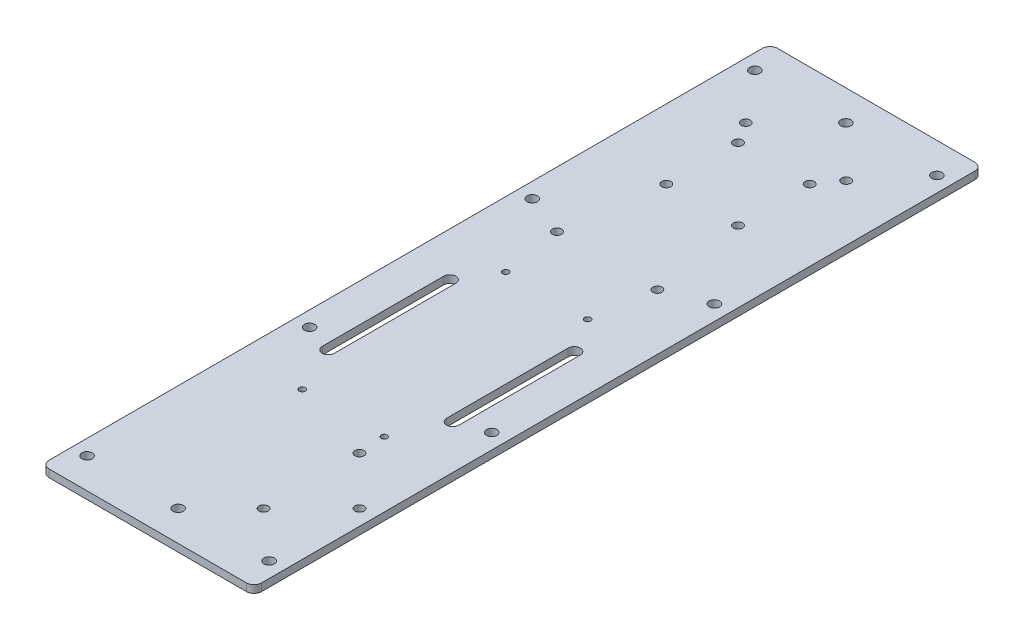
from build123d import *

# Parameters (mm, degrees)
PLATE_THICKNESS_DEPTH        = 3.175
SKETCH3_R                    = 2.159
MOUNTING_HOLES_DEPTH         = 159.781746826
SKETCH4_R                    = 1.905
JETSON_HOLES_W_O_MOUNT_DEPTH = 159.781746826
SKETCH5_R                    = 1.905
PDB_HOLES_DEPTH              = 159.781746826
SKETCH6_R                    = 1.905
LIDAR_HOLES_DEPTH            = 159.781746826
SKETCH7_R                    = 1.27
PIXHAWK_HOLES_DEPTH          = 159.781746826
BATTERY_HOLES_DEPTH          = 159.781746826


with BuildPart() as part:
    # Sketch2 → Plate Thickness (new body)
    with BuildSketch(Plane(origin=(0, 0, 0), x_dir=(1, 0, 0), z_dir=(0, 1, 0))):
        with BuildLine():
            Line((-41.275, 152.4), (41.275, 152.4))
            ThreePointArc((41.275, 152.4), (43.52006403, 151.47006403), (44.45, 149.225))
            Line((44.45, 149.225), (44.45, -149.225))
            ThreePointArc((44.45, -149.225), (43.52006403, -151.47006403), (41.275, -152.4))
            Line((41.275, -152.4), (-41.275, -152.4))
            ThreePointArc((-41.275, -152.4), (-43.52006403, -151.47006403), (-44.45, -149.225))
            Line((-44.45, -149.225), (-44.45, 149.225))
            ThreePointArc((-44.45, 149.225), (-43.52006403, 151.47006403), (-41.275, 152.4))
        make_face()
    extrude(amount=PLATE_THICKNESS_DEPTH)

    # Sketch3 → Mounting holes (cut, through all)
    with BuildSketch(Plane(origin=(0, 3.175, 0), x_dir=(1, 0, 0), z_dir=(0, 1, 0))):
        with Locations((-38.1, 139.7)):
            Circle(SKETCH3_R)
        with Locations((-38.1, 46.566666666)):
            Circle(SKETCH3_R)
        with Locations((-38.1, -46.56666582)):
            Circle(SKETCH3_R)
        with Locations((-38.1, -139.7)):
            Circle(SKETCH3_R)
        with Locations((38.1, -139.7)):
            Circle(SKETCH3_R)
        with Locations((38.1, -46.56666582)):
            Circle(SKETCH3_R)
        with Locations((38.1, 46.566666666)):
            Circle(SKETCH3_R)
        with Locations((38.1, 139.7)):
            Circle(SKETCH3_R)
        with Locations((0, 139.7)):
            Circle(SKETCH3_R)
        with Locations((0, -139.7)):
            Circle(SKETCH3_R)
    extrude(amount=-MOUNTING_HOLES_DEPTH, mode=Mode.SUBTRACT)

    # Sketch4 → Jetson Holes (w/o mount) (cut, through all)
    with BuildSketch(Plane(origin=(0, 3.175, 0), x_dir=(1, 0, 0), z_dir=(0, 1, 0))):
        with Locations((-21.0058, 118.808268359)):
            Circle(SKETCH4_R)
        with Locations((-21.0058, 39.814268359)):
            Circle(SKETCH4_R)
        with Locations((21.0058, 39.814268359)):
            Circle(SKETCH4_R)
        with Locations((21.0058, 118.808268359)):
            Circle(SKETCH4_R)
    extrude(amount=-JETSON_HOLES_W_O_MOUNT_DEPTH, mode=Mode.SUBTRACT)

    # Sketch5 → PDB holes (cut, through all)
    with BuildSketch(Plane(origin=(0, 3.175, 0), x_dir=(1, 0, 0), z_dir=(0, 1, 0))):
        with Locations((-15.378405846, 109.933938224)):
            Circle(SKETCH5_R)
        with Locations((14.618994154, 109.933938224)):
            Circle(SKETCH5_R)
        with Locations((14.618994154, 79.936538224)):
            Circle(SKETCH5_R)
        with Locations((-15.378405846, 79.936538224)):
            Circle(SKETCH5_R)
    extrude(amount=-PDB_HOLES_DEPTH, mode=Mode.SUBTRACT)

    # Sketch6 → Lidar Holes (cut, through all)
    with BuildSketch(Plane(origin=(0, 3.175, 0), x_dir=(1, 0, 0), z_dir=(0, 1, 0))):
        with Locations((37.983522463, -101.796635755)):
            Circle(SKETCH6_R)
        with Locations((17.917522463, -81.730635755)):
            Circle(SKETCH6_R)
        with Locations((17.917522463, -121.862635755)):
            Circle(SKETCH6_R)
    extrude(amount=-LIDAR_HOLES_DEPTH, mode=Mode.SUBTRACT)

    # Sketch7 → PixHawk Holes (cut, through all)
    with BuildSketch(Plane(origin=(0, 3.175, 0), x_dir=(1, 0, 0), z_dir=(0, 1, 0))):
        with Locations((-17.145, 14.489268954)):
            Circle(SKETCH7_R)
        with Locations((-17.145, -70.600731046)):
            Circle(SKETCH7_R)
        with Locations((17.145, -70.600731046)):
            Circle(SKETCH7_R)
        with Locations((17.145, 14.489268954)):
            Circle(SKETCH7_R)
    extrude(amount=-PIXHAWK_HOLES_DEPTH, mode=Mode.SUBTRACT)

    # Sketch8 → Battery Holes (cut, through all)
    with BuildSketch(Plane(origin=(0, 3.175, 0), x_dir=(1, 0, 0), z_dir=(0, 1, 0))):
        with BuildLine():
            Line((-23.495, -0.005964701), (-23.495, -50.805964701))
            ThreePointArc((-23.495, -50.805964701), (-26.035, -53.345964701), (-28.575, -50.805964701))
            Line((-28.575, -50.805964701), (-28.575, -0.005964701))
            ThreePointArc((-28.575, -0.005964701), (-26.035, 2.534035299), (-23.495, -0.005964701))
        make_face()
        with BuildLine():
            Line((23.495, -0.005964701), (23.495, -50.805964701))
            ThreePointArc((23.495, -50.805964701), (26.035, -53.345964701), (28.575, -50.805964701))
            Line((28.575, -50.805964701), (28.575, -0.005964701))
            ThreePointArc((28.575, -0.005964701), (26.035, 2.534035299), (23.495, -0.005964701))
        make_face()
    extrude(amount=-BATTERY_HOLES_DEPTH, mode=Mode.SUBTRACT)


solid = part.part
